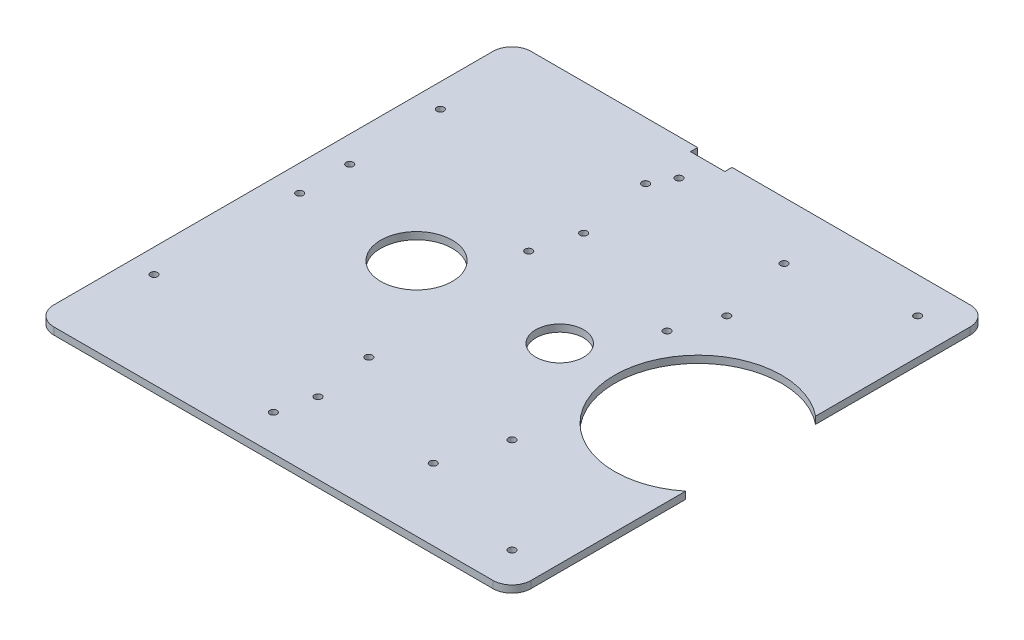
from build123d import *

# Parameters (mm, degrees)
SKETCH1_W               = 200
SKETCH1_H               = 200
BOSS_EXTRUDE1_DEPTH     = 3
CUT_EXTRUDE1_REACH      = 143.453
SKETCH2_R               = 1.5
CUT_EXTRUDE4_REACH      = 143.453
SKETCH4_R               = 1.5
CUT_EXTRUDE8_REACH      = 143.453
SKETCH10_R              = 35
CUT_EXTRUDE10_REACH     = 143.453
SKETCH12_R              = 1.5
FILLET2_R               = 8
CUT_EXTRUDE11_REACH     = 143.453
SKETCH13_R              = 1.5
CUT_EXTRUDE12_START     = -3
CUT_EXTRUDE12_OUTLINE_R = 1.5
CUT_EXTRUDE12_DEPTH     = 3
CUT_EXTRUDE13_REACH     = 143.453
SKETCH15_R              = 1.5
CUT_EXTRUDE14_REACH     = 143.453
SKETCH16_W              = 14.4
SKETCH16_H              = 3
CUT_EXTRUDE15_REACH     = 143.453
SKETCH17_R              = 15
SKETCH17_R_2            = 10


# Read off the part's stored shape, not the designer's step: Cut-Extrude12
with BuildPart() as part:
    # Sketch1 → Boss-Extrude1 (new body)
    with BuildSketch(Plane(origin=(0, 0, 0), x_dir=(1, 0, 0), z_dir=(0, 1, 0))):
        Rectangle(SKETCH1_W, SKETCH1_H)
    extrude(amount=BOSS_EXTRUDE1_DEPTH)

    # Sketch2 → Cut-Extrude1 (cut, up to next)
    with BuildSketch(Plane.XZ, mode=Mode.PRIVATE) as cut_extrude1_sk1:
        with Locations(Location((85, 20, 0), (0, 0, 270))):
            Circle(SKETCH2_R)
    cut_extrude1_tool1 = extrude(cut_extrude1_sk1.sketch, amount=-CUT_EXTRUDE1_REACH, mode=Mode.PRIVATE) & part.part
    # Sketch2 → Cut-Extrude1 (cut, up to next)
    with BuildSketch(Plane.XZ, mode=Mode.PRIVATE) as cut_extrude1_sk2:
        with Locations(Location((85, -20, 0), (0, 0, 270))):
            Circle(SKETCH2_R)
    cut_extrude1_tool2 = extrude(cut_extrude1_sk2.sketch, amount=-CUT_EXTRUDE1_REACH, mode=Mode.PRIVATE) & part.part
    add(cut_extrude1_tool1.solids().sort_by_distance((85, 0, 20))[0], mode=Mode.SUBTRACT)
    add(cut_extrude1_tool2.solids().sort_by_distance((85, 0, -20))[0], mode=Mode.SUBTRACT)

    # Sketch4 → Cut-Extrude4 (cut, up to next)
    with BuildSketch(Plane.XZ, mode=Mode.PRIVATE) as cut_extrude4_sk1:
        with Locations(Location((-15, 45, 0), (0, 0, 270))):
            Circle(SKETCH4_R)
    cut_extrude4_tool1 = extrude(cut_extrude4_sk1.sketch, amount=-CUT_EXTRUDE4_REACH, mode=Mode.PRIVATE) & part.part
    # Sketch4 → Cut-Extrude4 (cut, up to next)
    with BuildSketch(Plane.XZ, mode=Mode.PRIVATE) as cut_extrude4_sk2:
        with Locations(Location((45, 45, 0), (0, 0, 270))):
            Circle(SKETCH4_R)
    cut_extrude4_tool2 = extrude(cut_extrude4_sk2.sketch, amount=-CUT_EXTRUDE4_REACH, mode=Mode.PRIVATE) & part.part
    # Sketch4 → Cut-Extrude4 (cut, up to next)
    with BuildSketch(Plane.XZ, mode=Mode.PRIVATE) as cut_extrude4_sk3:
        with Locations(Location((45, -45, 0), (0, 0, 270))):
            Circle(SKETCH4_R)
    cut_extrude4_tool3 = extrude(cut_extrude4_sk3.sketch, amount=-CUT_EXTRUDE4_REACH, mode=Mode.PRIVATE) & part.part
    # Sketch4 → Cut-Extrude4 (cut, up to next)
    with BuildSketch(Plane.XZ, mode=Mode.PRIVATE) as cut_extrude4_sk4:
        with Locations(Location((-15, -45, 0), (0, 0, 270))):
            Circle(SKETCH4_R)
    cut_extrude4_tool4 = extrude(cut_extrude4_sk4.sketch, amount=-CUT_EXTRUDE4_REACH, mode=Mode.PRIVATE) & part.part
    add(cut_extrude4_tool1.solids().sort_by_distance((-15, 0, 45))[0], mode=Mode.SUBTRACT)
    add(cut_extrude4_tool2.solids().sort_by_distance((45, 0, 45))[0], mode=Mode.SUBTRACT)
    add(cut_extrude4_tool3.solids().sort_by_distance((45, 0, -45))[0], mode=Mode.SUBTRACT)
    add(cut_extrude4_tool4.solids().sort_by_distance((-15, 0, -45))[0], mode=Mode.SUBTRACT)

    # Sketch10 → Cut-Extrude8 (cut, up to next)
    with BuildSketch(Plane(origin=(0, 0, 0), x_dir=(-1, 0, 0), z_dir=(0, -1, 0)), mode=Mode.PRIVATE) as cut_extrude8_sk1:
        with Locations((-78, 0)):
            Circle(SKETCH10_R)
    cut_extrude8_tool1 = extrude(cut_extrude8_sk1.sketch, amount=-CUT_EXTRUDE8_REACH, mode=Mode.PRIVATE) & part.part
    add(cut_extrude8_tool1.solids().sort_by_distance((78, 0, 0))[0], mode=Mode.SUBTRACT)

    # Sketch12 → Cut-Extrude10 (cut, up to next)
    with BuildSketch(Plane(origin=(0, 0, 0), x_dir=(1, 0, 0), z_dir=(0, 1, 0)), mode=Mode.PRIVATE) as cut_extrude10_sk1:
        with Locations(Location((-89, 0, 0), (0, 0, 90))):
            Circle(SKETCH12_R)
    cut_extrude10_tool1 = extrude(cut_extrude10_sk1.sketch, amount=CUT_EXTRUDE10_REACH, mode=Mode.PRIVATE) & part.part
    # Sketch12 → Cut-Extrude10 (cut, up to next)
    with BuildSketch(Plane(origin=(0, 0, 0), x_dir=(1, 0, 0), z_dir=(0, 1, 0)), mode=Mode.PRIVATE) as cut_extrude10_sk2:
        with Locations(Location((-89, 21, 0), (0, 0, 90))):
            Circle(SKETCH12_R)
    cut_extrude10_tool2 = extrude(cut_extrude10_sk2.sketch, amount=CUT_EXTRUDE10_REACH, mode=Mode.PRIVATE) & part.part
    add(cut_extrude10_tool1.solids().sort_by_distance((-89, 0, 0))[0], mode=Mode.SUBTRACT)
    add(cut_extrude10_tool2.solids().sort_by_distance((-89, 0, -21))[0], mode=Mode.SUBTRACT)

    # Fillet2
    fillet2_edges = [part.edges().sort_by_distance(p)[0] for p in [
        (100, 1.5, 100),
        (-100, 1.5, 100),
        (-100, 1.5, -100),
        (100, 1.5, -100),
    ]]
    fillet(fillet2_edges, radius=FILLET2_R)

    # Sketch13 → Cut-Extrude11 (cut, up to next)
    with BuildSketch(Plane(origin=(0, 0, 0), x_dir=(1, 0, 0), z_dir=(0, 1, 0)), mode=Mode.PRIVATE) as cut_extrude11_sk1:
        with Locations(Location((37, -70, 0), (0, 0, 90))):
            Circle(SKETCH13_R)
    cut_extrude11_tool1 = extrude(cut_extrude11_sk1.sketch, amount=CUT_EXTRUDE11_REACH, mode=Mode.PRIVATE) & part.part
    # Sketch13 → Cut-Extrude11 (cut, up to next)
    with BuildSketch(Plane(origin=(0, 0, 0), x_dir=(1, 0, 0), z_dir=(0, 1, 0)), mode=Mode.PRIVATE) as cut_extrude11_sk2:
        with Locations(Location((-11.3, -70, 0), (0, 0, 90))):
            Circle(SKETCH13_R)
    cut_extrude11_tool2 = extrude(cut_extrude11_sk2.sketch, amount=CUT_EXTRUDE11_REACH, mode=Mode.PRIVATE) & part.part
    add(cut_extrude11_tool1.solids().sort_by_distance((37, 0, 70))[0], mode=Mode.SUBTRACT)
    add(cut_extrude11_tool2.solids().sort_by_distance((-11.3, 0, 70))[0], mode=Mode.SUBTRACT)

    # Cut-Extrude12 outline → Cut-Extrude12 (cut)
    with BuildSketch(Plane(origin=(0, 3, 0), x_dir=(1, 0, 0), z_dir=(0, 1, 0)).offset(CUT_EXTRUDE12_START)):
        with Locations((-20, 27)):
            Circle(CUT_EXTRUDE12_OUTLINE_R)
        with Locations((38, 76)):
            Circle(CUT_EXTRUDE12_OUTLINE_R)
        with Locations((-20, 76)):
            Circle(CUT_EXTRUDE12_OUTLINE_R)
        with Locations((38, 27)):
            Circle(CUT_EXTRUDE12_OUTLINE_R)
    extrude(amount=CUT_EXTRUDE12_DEPTH, mode=Mode.SUBTRACT)

    # Sketch15 → Cut-Extrude13 (cut, up to next)
    with BuildSketch(Plane.XZ, mode=Mode.PRIVATE) as cut_extrude13_sk1:
        with Locations(Location((-90, 60, 0), (0, 0, 270))):
            Circle(SKETCH15_R)
    cut_extrude13_tool1 = extrude(cut_extrude13_sk1.sketch, amount=-CUT_EXTRUDE13_REACH, mode=Mode.PRIVATE) & part.part
    # Sketch15 → Cut-Extrude13 (cut, up to next)
    with BuildSketch(Plane.XZ, mode=Mode.PRIVATE) as cut_extrude13_sk2:
        with Locations(Location((-90, -60, 0), (0, 0, 270))):
            Circle(SKETCH15_R)
    cut_extrude13_tool2 = extrude(cut_extrude13_sk2.sketch, amount=-CUT_EXTRUDE13_REACH, mode=Mode.PRIVATE) & part.part
    # Sketch15 → Cut-Extrude13 (cut, up to next)
    with BuildSketch(Plane.XZ, mode=Mode.PRIVATE) as cut_extrude13_sk3:
        with Locations(Location((-15, -85, 0), (0, 0, 270))):
            Circle(SKETCH15_R)
    cut_extrude13_tool3 = extrude(cut_extrude13_sk3.sketch, amount=-CUT_EXTRUDE13_REACH, mode=Mode.PRIVATE) & part.part
    # Sketch15 → Cut-Extrude13 (cut, up to next)
    with BuildSketch(Plane.XZ, mode=Mode.PRIVATE) as cut_extrude13_sk4:
        with Locations(Location((85, -85, 0), (0, 0, 270))):
            Circle(SKETCH15_R)
    cut_extrude13_tool4 = extrude(cut_extrude13_sk4.sketch, amount=-CUT_EXTRUDE13_REACH, mode=Mode.PRIVATE) & part.part
    # Sketch15 → Cut-Extrude13 (cut, up to next)
    with BuildSketch(Plane.XZ, mode=Mode.PRIVATE) as cut_extrude13_sk5:
        with Locations(Location((-15, 85, 0), (0, 0, 270))):
            Circle(SKETCH15_R)
    cut_extrude13_tool5 = extrude(cut_extrude13_sk5.sketch, amount=-CUT_EXTRUDE13_REACH, mode=Mode.PRIVATE) & part.part
    # Sketch15 → Cut-Extrude13 (cut, up to next)
    with BuildSketch(Plane.XZ, mode=Mode.PRIVATE) as cut_extrude13_sk6:
        with Locations(Location((85, 85, 0), (0, 0, 270))):
            Circle(SKETCH15_R)
    cut_extrude13_tool6 = extrude(cut_extrude13_sk6.sketch, amount=-CUT_EXTRUDE13_REACH, mode=Mode.PRIVATE) & part.part
    add(cut_extrude13_tool1.solids().sort_by_distance((-90, 0, 60))[0], mode=Mode.SUBTRACT)
    add(cut_extrude13_tool2.solids().sort_by_distance((-90, 0, -60))[0], mode=Mode.SUBTRACT)
    add(cut_extrude13_tool3.solids().sort_by_distance((-15, 0, -85))[0], mode=Mode.SUBTRACT)
    add(cut_extrude13_tool4.solids().sort_by_distance((85, 0, -85))[0], mode=Mode.SUBTRACT)
    add(cut_extrude13_tool5.solids().sort_by_distance((-15, 0, 85))[0], mode=Mode.SUBTRACT)
    add(cut_extrude13_tool6.solids().sort_by_distance((85, 0, 85))[0], mode=Mode.SUBTRACT)

    # Sketch16 → Cut-Extrude14 (cut, up to next)
    with BuildSketch(Plane(origin=(0, 3, 0), x_dir=(1, 0, 0), z_dir=(0, 1, 0)), mode=Mode.PRIVATE) as cut_extrude14_sk1:
        with Locations((-15, 98.5)):
            Rectangle(SKETCH16_W, SKETCH16_H)
    cut_extrude14_tool1 = extrude(cut_extrude14_sk1.sketch, amount=-CUT_EXTRUDE14_REACH, mode=Mode.PRIVATE) & part.part
    add(cut_extrude14_tool1.solids().sort_by_distance((-15, 3, -98.5))[0], mode=Mode.SUBTRACT)

    # Sketch17 → Cut-Extrude15 (cut, up to next)
    with BuildSketch(Plane(origin=(0, 0, 0), x_dir=(1, 0, 0), z_dir=(0, 1, 0)), mode=Mode.PRIVATE) as cut_extrude15_sk1:
        with Locations(Location((-40, 0, 0), (0, 0, 90))):
            Circle(SKETCH17_R)
    cut_extrude15_tool1 = extrude(cut_extrude15_sk1.sketch, amount=CUT_EXTRUDE15_REACH, mode=Mode.PRIVATE) & part.part
    # Sketch17 → Cut-Extrude15 (cut, up to next)
    with BuildSketch(Plane(origin=(0, 0, 0), x_dir=(1, 0, 0), z_dir=(0, 1, 0)), mode=Mode.PRIVATE) as cut_extrude15_sk2:
        with Locations(Location((20, 0, 0), (0, 0, 90))):
            Circle(SKETCH17_R_2)
    cut_extrude15_tool2 = extrude(cut_extrude15_sk2.sketch, amount=CUT_EXTRUDE15_REACH, mode=Mode.PRIVATE) & part.part
    add(cut_extrude15_tool1.solids().sort_by_distance((-40, 0, 0))[0], mode=Mode.SUBTRACT)
    add(cut_extrude15_tool2.solids().sort_by_distance((20, 0, 0))[0], mode=Mode.SUBTRACT)


solid = part.part
